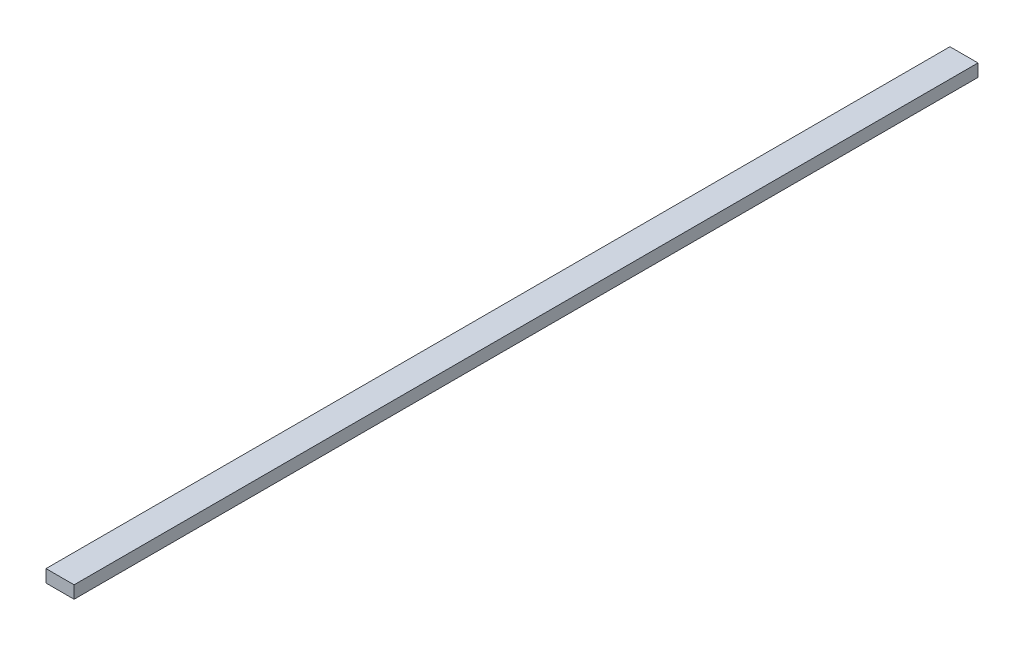
from build123d import *

# Parameters (mm, degrees)
SKETCH1_W           = 16.6624
SKETCH1_H           = 37.2872
BOSS_EXTRUDE1_DEPTH = 600


with BuildPart() as part:
    # Sketch1 → Boss-Extrude1 (new, symmetric)
    with BuildSketch(Plane(origin=(0, 0, 0), x_dir=(0, 1, 0), z_dir=(0, 0, 1))):
        Rectangle(SKETCH1_W, SKETCH1_H)
    extrude(amount=BOSS_EXTRUDE1_DEPTH, both=True)


solid = part.part
